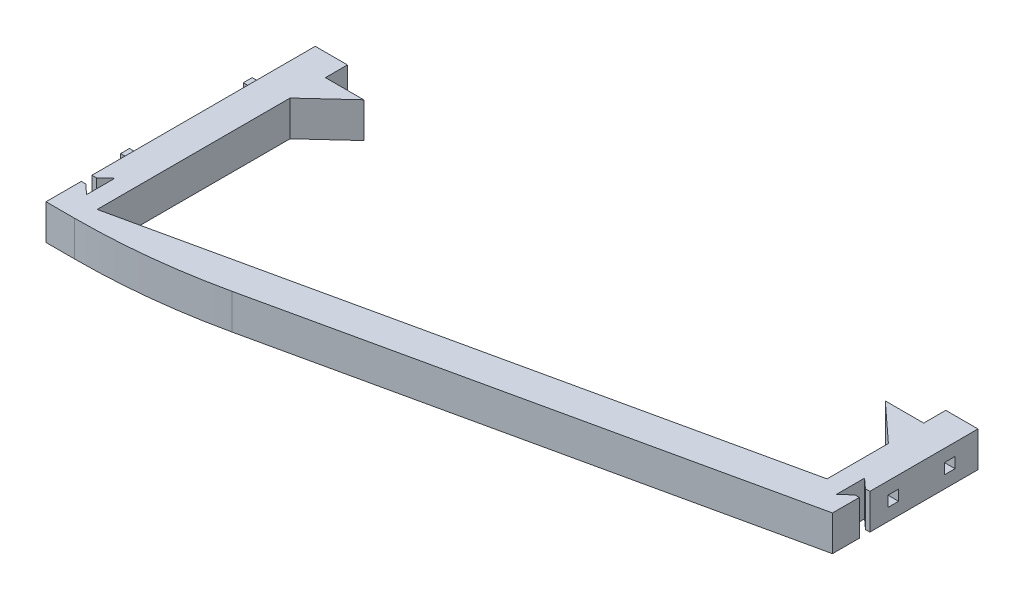
from build123d import *

# Parameters (mm, degrees)
P_IDAT_VYSUNUT_M1_DEPTH  = 8
ODEBRAT_VYSUNUT_M1_DEPTH = 165.210299616
SKICA3_W                 = 2
SKICA3_H                 = 2
P_IDAT_VYSUNUT_M2_DEPTH  = 4
SKICA5_W                 = 16
SKICA5_H                 = 8
P_IDAT_VYSUNUT_M3_DEPTH  = 8
ODEBRAT_VYSUNUT_M4_DEPTH = 165.210299616
SKICA4_W                 = 2.4
SKICA4_H                 = 2.4
ODEBRAT_VYSUNUT_M2_DEPTH = 4.4
ODEBRAT_VYSUNUT_M5_DEPTH = 165.210299616
ODEBRAT_VYSUNUT_M6_DEPTH = 165.210299616
ZAOBLIT1_R               = 150


with BuildPart() as part:
    # Skica1 → Přidat vysunutím1 (new body)
    with BuildSketch(Plane(origin=(0, 0, 0), x_dir=(1, 0, 0), z_dir=(0, 1, 0))):
        Polygon((0, 0), (0, -66), (150.15, -32.968149881), (150.15, 0), (142.85, 0), (142.85, -26.894750875), (7.3, -56.714712804), (7.3, 0), align=None)
    extrude(amount=P_IDAT_VYSUNUT_M1_DEPTH)

    # Skica2 → Odebrat vysunutím1 (cut, through all)
    with BuildSketch(Plane(origin=(0, 8, 0), x_dir=(1, 0, 0), z_dir=(0, 1, 0))):
        Polygon((0, -50.6), (1, -50.6), (3.2, -48.6), (3.2, -55), (1, -53), (0, -53), align=None)
    extrude(amount=-ODEBRAT_VYSUNUT_M1_DEPTH, mode=Mode.SUBTRACT)

    # Skica3 → Přidat vysunutím2 (add)
    with BuildSketch(Plane.ZY):
        with Locations((11.3, 4)):
            Rectangle(SKICA3_W, SKICA3_H)
        with Locations((39.1, 4)):
            Rectangle(SKICA3_W, SKICA3_H)
    extrude(amount=P_IDAT_VYSUNUT_M2_DEPTH)

    # Skica5 → Přidat vysunutím3 (add)
    with BuildSketch(Plane(origin=(0, 8, 0), x_dir=(1, 0, 0), z_dir=(0, 1, 0))):
        with Locations((8, -9)):
            Rectangle(SKICA5_W, SKICA5_H)
        with Locations((142.15, -9)):
            Rectangle(SKICA5_W, SKICA5_H)
    extrude(amount=-P_IDAT_VYSUNUT_M3_DEPTH)

    # Skica7 → Odebrat vysunutím4 (cut, through all)
    with BuildSketch(Plane.XZ):
        Polygon((7.3, 13), (16, 5), (16, 13), align=None)
        Polygon((134.15, 5), (134.15, 13), (142.85, 13), align=None)
    extrude(amount=-ODEBRAT_VYSUNUT_M4_DEPTH, mode=Mode.SUBTRACT)

    # Skica4 → Odebrat vysunutím2 (cut)
    with BuildSketch(Plane(origin=(150.15, 0, 0), x_dir=(0, 0, -1), z_dir=(1, 0, 0))):
        with Locations((-19.2, 4)):
            Rectangle(SKICA4_W, SKICA4_H)
        with Locations((-6.4, 4)):
            Rectangle(SKICA4_W, SKICA4_H)
    extrude(amount=-ODEBRAT_VYSUNUT_M2_DEPTH, mode=Mode.SUBTRACT)

    # Skica8 → Odebrat vysunutím5 (cut, through all)
    with BuildSketch(Plane(origin=(0, 8, 0), x_dir=(1, 0, 0), z_dir=(0, 1, 0))):
        Polygon((150.15, -24.5), (149.15, -24.5), (146.95, -22.5), (146.95, -28.9), (149.15, -26.9), (150.15, -26.9), align=None)
    extrude(amount=-ODEBRAT_VYSUNUT_M5_DEPTH, mode=Mode.SUBTRACT)

    # Skica9 → Odebrat vysunutím6 (cut, through all)
    with BuildSketch(Plane(origin=(0, 8, 0), x_dir=(1, 0, 0), z_dir=(0, 1, 0))):
        Polygon((0, -61), (22.728063893, -61), (0, -66), align=None)
    extrude(amount=-ODEBRAT_VYSUNUT_M6_DEPTH, mode=Mode.SUBTRACT)

    # Zaoblit1
    zaoblit1_edges = [part.edges().sort_by_distance(p)[0] for p in [
        (22.728063893, 4, 61),
    ]]
    fillet(zaoblit1_edges, radius=ZAOBLIT1_R)


solid = part.part
